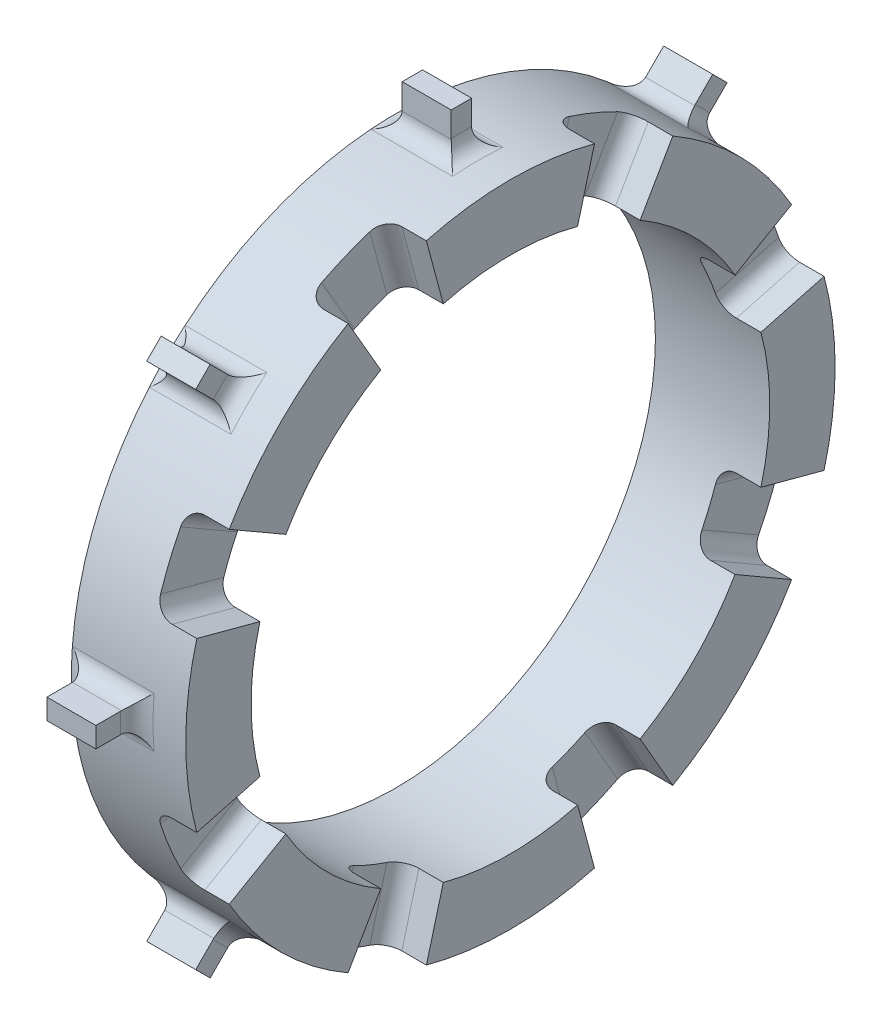
from build123d import *

# Parameters (mm, degrees)
SKETCH1_R                = 39.75
SKETCH1_R_2              = 31.75
BOSS_EXTRUDE1_DEPTH      = 14
BOSS_EXTRUDE2_START      = -6
BOSS_EXTRUDE2_DEPTH      = 6
CIRPATTERN1_COUNT        = 8
FILLET1_R                = 2
CUT_EXTRUDE2_START       = -5
CUT_EXTRUDE2_DEPTH       = 5
FILLET2_R                = 2
CIRPATTERN2_COUNT        = 8
FILLET2_OF_CIRPATTERN2_R = 2


with BuildPart() as part:
    # Sketch1 → Boss-Extrude1 (new body)
    with BuildSketch(Plane(origin=(0, 0, 0), x_dir=(0, 0, -1), z_dir=(1, 0, 0))):
        Circle(SKETCH1_R)
        Circle(SKETCH1_R_2, mode=Mode.SUBTRACT)
    extrude(amount=BOSS_EXTRUDE1_DEPTH)

    # Sketch2 → Boss-Extrude2 (add)
    with BuildSketch(Plane(origin=(8, 0, 0), x_dir=(0, 0, -1), z_dir=(1, 0, 0)).offset(BOSS_EXTRUDE2_START)):
        with BuildLine():
            Line((39.730341051, 1.25), (44.75, 1.25))
            Line((44.75, 1.25), (44.75, -1.25))
            Line((44.75, -1.25), (39.730341051, -1.25))
            ThreePointArc((39.730341051, -1.25), (39.75, 0), (39.730341051, 1.25))
        make_face()
    boss_extrude2 = extrude(amount=BOSS_EXTRUDE2_DEPTH)

    # CirPattern1: Boss-Extrude2 ×8 about axis
    cirpattern1_axis = Axis((0, 0, 0), (1, 0, 0))
    for i in range(1, CIRPATTERN1_COUNT):
        add(boss_extrude2.rotate(cirpattern1_axis, i * 360 / CIRPATTERN1_COUNT))

    # Fillet1
    fillet1_edges = [part.edges().sort_by_distance(p)[0] for p in [
        (8, -0.62507729, -39.745084959),
        (5, -1.25, -39.730341051),
        (5, 1.25, -39.730341051),
        (2, -0.62507729, -39.745084959),
        (8, -28.107494552, -28.107494552),
        (5, -28.977477052, -27.209710099),
        (5, -27.209710099, -28.977477052),
        (2, -28.107494552, -28.107494552),
        (8, -39.75, 0),
        (5, -39.730341051, 1.25),
        (5, -39.730341051, -1.25),
        (2, -39.75, 0),
        (8, -28.107494552, 28.107494552),
        (5, -27.209710099, 28.977477052),
        (5, -28.977477052, 27.209710099),
        (2, -28.107494552, 28.107494552),
        (8, 0, 39.75),
        (5, 1.25, 39.730341051),
        (5, -1.25, 39.730341051),
        (2, 0, 39.75),
        (8, 28.107494552, 28.107494552),
        (5, 28.977477052, 27.209710099),
        (5, 27.209710099, 28.977477052),
        (2, 28.107494552, 28.107494552),
        (8, 39.75, 0),
        (5, 39.730341051, -1.25),
        (5, 39.730341051, 1.25),
        (2, 39.75, 0),
        (8, 28.107494552, -28.107494552),
        (5, 27.209710099, -28.977477052),
        (5, 28.977477052, -27.209710099),
        (2, 28.107494552, -28.107494552),
    ]]
    fillet(fillet1_edges, radius=FILLET1_R - 0.0001)  # a hair under: the kernel refuses the full size

    # Sketch3 → Cut-Extrude2 (cut)
    with BuildSketch(Plane(origin=(14, 0, 0), x_dir=(0, 0, -1), z_dir=(1, 0, 0)).offset(CUT_EXTRUDE2_START)):
        with BuildLine():
            Line((36.724211417, -15.211666437), (0, 0))
            Line((0, 0), (34.4245098, -19.875))
            ThreePointArc((34.4245098, -19.875), (35.650691476, -17.580975436), (36.724211417, -15.211666437))
        make_face()
        with BuildLine():
            Line((38.395551595, -10.288057043), (0, 0))
            Line((0, 0), (36.724211417, -15.211666437))
            ThreePointArc((36.724211417, -15.211666437), (37.640472647, -12.777218746), (38.395551595, -10.288057043))
        make_face()
    cut_extrude2 = extrude(amount=CUT_EXTRUDE2_DEPTH, mode=Mode.SUBTRACT)

    # Fillet2
    fillet2_edges = [part.edges().sort_by_distance(p)[0] for p in [
        (9, -17.875, -30.960408185),
        (9, -9.252780862, -34.53184829),
    ]]
    fillet(fillet2_edges, radius=FILLET2_R)

    # CirPattern2: Cut-Extrude2 ×8 about axis
    cirpattern2_axis = Axis((0, 0, 0), (1, 0, 0))
    for i in range(1, CIRPATTERN2_COUNT):
        add(cut_extrude2.rotate(cirpattern2_axis, i * 360 / CIRPATTERN2_COUNT), mode=Mode.SUBTRACT)

    # Fillet2 of CirPattern2
    fillet2_of_cirpattern2_edges = [part.edges().sort_by_distance(p)[0] for p in [
        (9, 9.252780862, -34.53184829),
        (9, 17.875, -30.960408185),
        (9, 30.960408185, -17.875),
        (9, 34.53184829, -9.252780862),
        (9, 34.53184829, 9.252780862),
        (9, 30.960408185, 17.875),
        (9, 17.875, 30.960408185),
        (9, 9.252780862, 34.53184829),
        (9, -9.252780862, 34.53184829),
        (9, -17.875, 30.960408185),
        (9, -30.960408185, 17.875),
        (9, -34.53184829, 9.252780862),
        (9, -34.53184829, -9.252780862),
        (9, -30.960408185, -17.875),
    ]]
    fillet(fillet2_of_cirpattern2_edges, radius=FILLET2_OF_CIRPATTERN2_R)


solid = part.part
